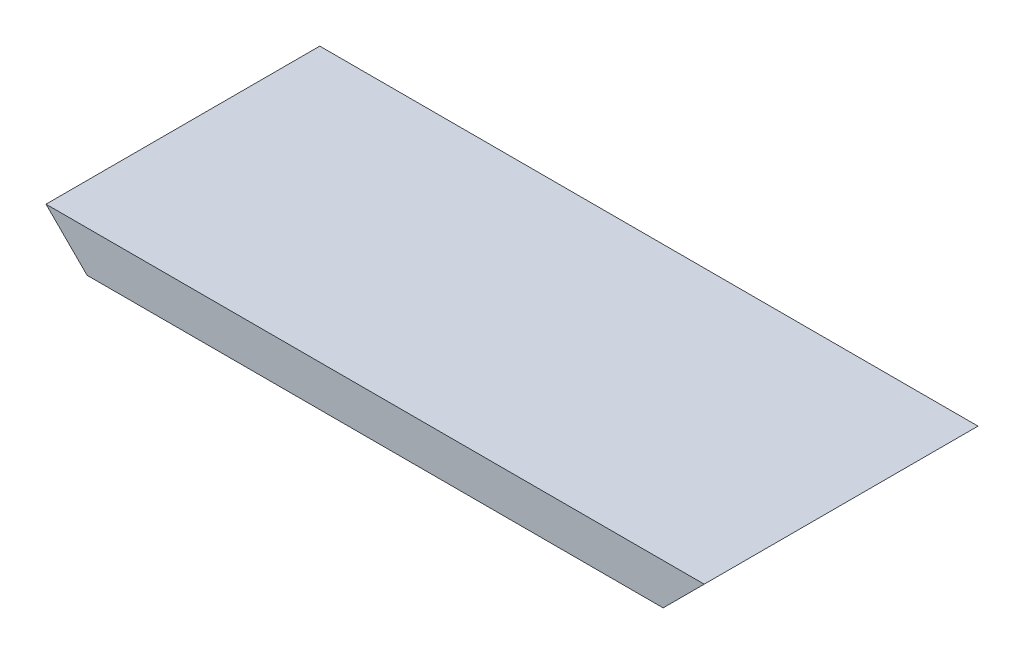
from build123d import *

# Parameters (mm, degrees)
BOSS_EXTRUDE1_DEPTH = 18
SKETCH4_W           = 12
SKETCH4_H           = 8
CUT_EXTRUDE1_DEPTH  = 2
FILLET1_R           = 10
FILLET2_R           = 0.5


with BuildPart() as part:
    # Sketch2 → Boss-Extrude1 (new body)
    with BuildSketch(Plane.XY):
        Polygon((21.637867966, 2.85), (18.937867966, 0.15), (-18.937867966, 0.15), (-21.637867966, 2.85), align=None)
    extrude(amount=-BOSS_EXTRUDE1_DEPTH)

    # Sketch4 → Cut-Extrude1 (cut)
    with BuildSketch(Plane.XZ.offset(-0.15)):
        with Locations((0, -7)):
            Rectangle(SKETCH4_W, SKETCH4_H)
    extrude(amount=-CUT_EXTRUDE1_DEPTH, mode=Mode.SUBTRACT)

    # Fillet1
    # the kernel refuses this fillet: 10 mm, written as the material it adds along each edge
    with BuildSketch(Plane(origin=(6, 2.15, -11), x_dir=(0, -1, 0), z_dir=(-1, 0, 0))) as fillet1_piece_1:
        with BuildLine():
            CenterArc((10, 6), FILLET1_R, 180, 36.869897646)
            Line((0, 6), (0, 0))
            Line((0, 0), (2, 0))
        make_face()
    extrude(amount=12)

    # Fillet2
    fillet2_edges = [part.edges().sort_by_distance(p)[0] for p in [
        (0, 2.15, -3),
    ]]
    fillet(fillet2_edges, radius=FILLET2_R)


solid = part.part
